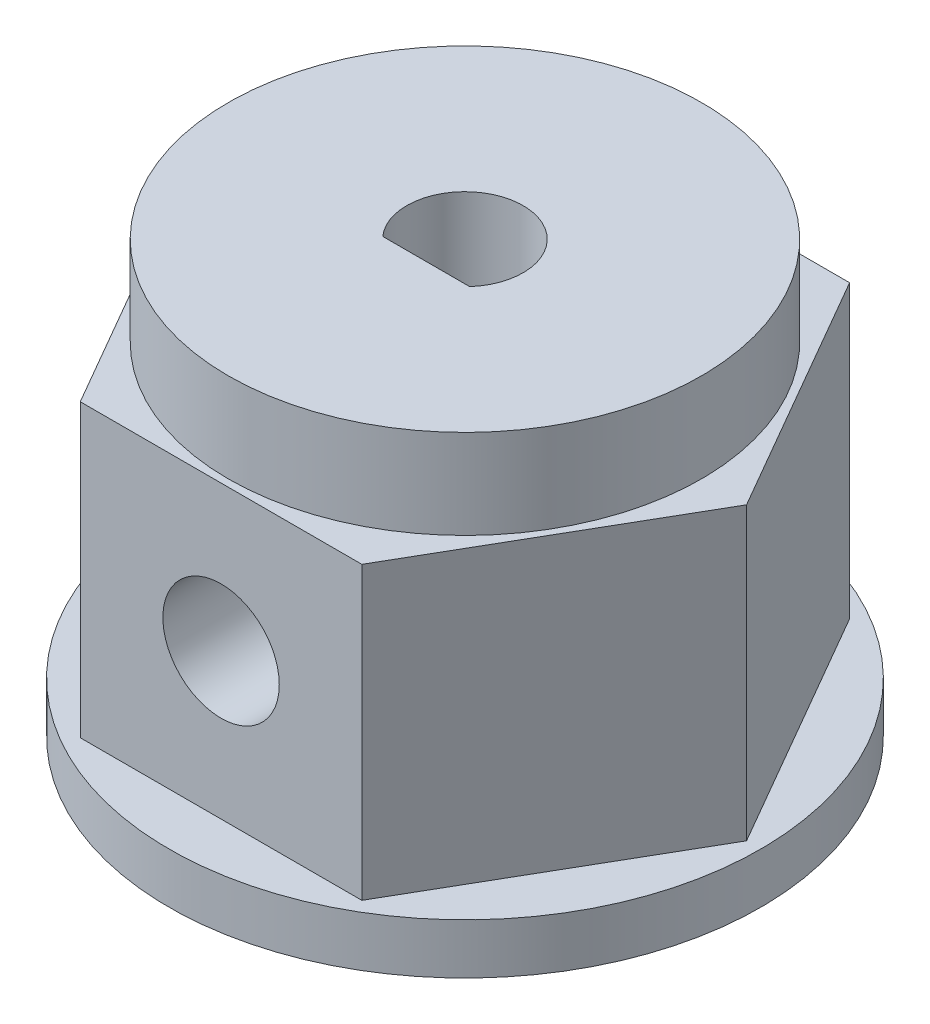
from build123d import *

# Parameters (mm, degrees)
BOSS_EXTRUDE1_DEPTH = 7.5
SKETCH2_R           = 6.1
BOSS_EXTRUDE2_DEPTH = 2.3
SKETCH3_R           = 7.625
BOSS_EXTRUDE3_DEPTH = 1.3
CUT_EXTRUDE1_DEPTH  = 16.475504838
CUT_EXTRUDE2_REACH  = 20.646
SKETCH5_R           = 1.5


with BuildPart() as part:
    # Sketch1 → Boss-Extrude1 (new body)
    with BuildSketch(Plane(origin=(0, 0, 0), x_dir=(1, 0, 0), z_dir=(0, 1, 0))):
        Polygon((7.257292884, 0), (3.628646442, 6.285), (-3.628646442, 6.285), (-7.257292884, 0), (-3.628646442, -6.285), (3.628646442, -6.285), align=None)
    extrude(amount=BOSS_EXTRUDE1_DEPTH)

    # Sketch2 → Boss-Extrude2 (add)
    with BuildSketch(Plane(origin=(0, 7.5, 0), x_dir=(1, 0, 0), z_dir=(0, 1, 0))):
        Circle(SKETCH2_R)
    extrude(amount=BOSS_EXTRUDE2_DEPTH)

    # Sketch3 → Boss-Extrude3 (add)
    with BuildSketch(Plane.XZ):
        Circle(SKETCH3_R)
    extrude(amount=BOSS_EXTRUDE3_DEPTH)

    # Sketch4 → Cut-Extrude1 (cut, through all)
    with BuildSketch(Plane(origin=(0, 9.8, 0), x_dir=(1, 0, 0), z_dir=(0, 1, 0))):
        with BuildLine():
            Line((-1.12, -0.997797575), (1.12, -0.997797575))
            ThreePointArc((1.12, -0.997797575), (0, 1.5), (-1.12, -0.997797575))
        make_face()
    extrude(amount=-CUT_EXTRUDE1_DEPTH, mode=Mode.SUBTRACT)

    # Sketch5 → Cut-Extrude2 (cut, up to next)
    with BuildSketch(Plane.XY.offset(6.285), mode=Mode.PRIVATE) as cut_extrude2_sk1:
        with Locations((0, 3.75)):
            Circle(SKETCH5_R)
    cut_extrude2_tool1 = extrude(cut_extrude2_sk1.sketch, amount=-CUT_EXTRUDE2_REACH, mode=Mode.PRIVATE) & part.part
    add(cut_extrude2_tool1.solids().sort_by_distance((0, 3.75, 6.285))[0], mode=Mode.SUBTRACT)


solid = part.part
